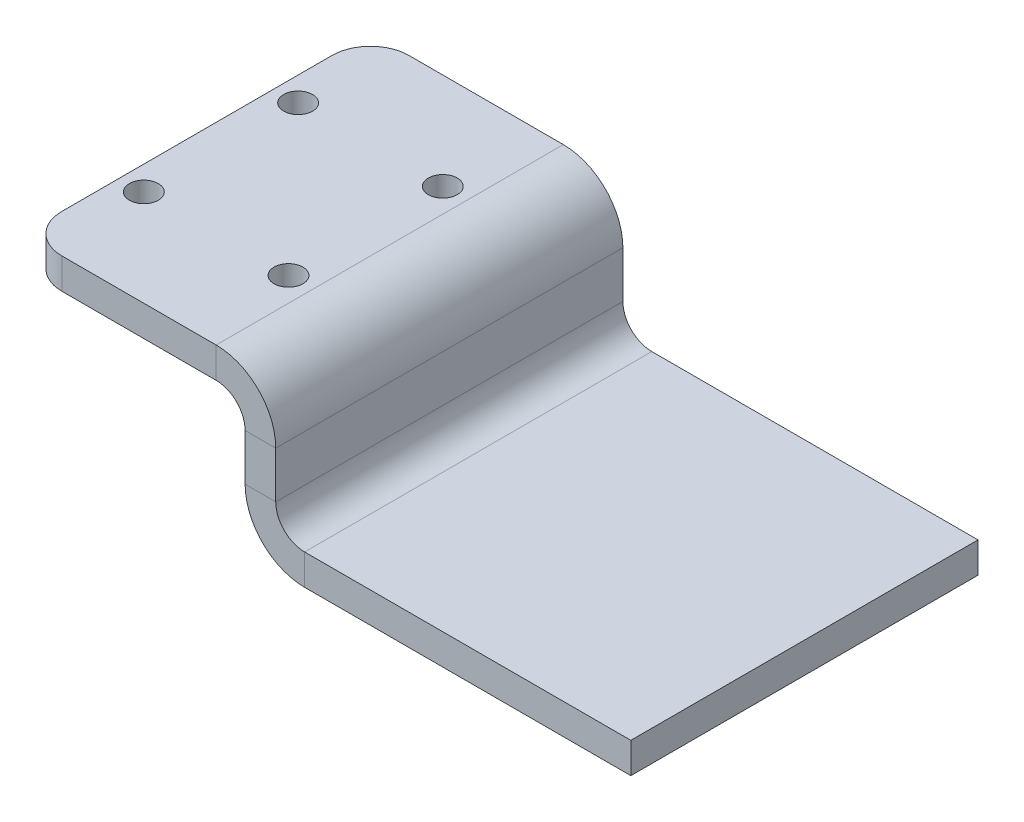
from build123d import *

# Parameters (mm, degrees)
SKETCH2_W                    = 23
SKETCH2_H                    = 36
BASE_FLANGE1_DEPTH           = 3.175
EDGE_FLANGE4_STRIP_W         = 18.7
EDGE_FLANGE4_STRIP_H         = 3.175
EDGE_FLANGE4_STRIP_CUT_DEPTH = 36
EDGE_FLANGE4_DEPTH           = 36
EDGE_FLANGE5_STRIP_W         = 18.7
EDGE_FLANGE5_STRIP_H         = 3.175
EDGE_FLANGE5_STRIP_CUT_DEPTH = 36
EDGE_FLANGE5_DEPTH           = 36
SKETCH20_R                   = 1.5
CUT_EXTRUDE1_DEPTH           = 68.734633866
FILLET1_R                    = 4


# Sheet-metal steps are written as plain solids
with BuildPart() as part:
    # Sketch2 → Base-Flange1 (new body)
    with BuildSketch(Plane(origin=(0, 0, 0), x_dir=(1, 0, 0), z_dir=(0, 1, 0))):
        with Locations((11.5, 0)):
            Rectangle(SKETCH2_W, SKETCH2_H)
    extrude(amount=-BASE_FLANGE1_DEPTH)

    # Edge-Flange4 strip (across the edge) → Edge-Flange4 strip cut (cut)
    with BuildSketch(Plane(origin=(23, -3.175, -18), x_dir=(-1, 0, 0), z_dir=(0, 0, 1))):
        with Locations((-6.35, -1.5875)):
            Rectangle(EDGE_FLANGE4_STRIP_W, EDGE_FLANGE4_STRIP_H)
    extrude(amount=EDGE_FLANGE4_STRIP_CUT_DEPTH, mode=Mode.SUBTRACT)

    # Edge-Flange4 section (across the edge) → Edge-Flange4 (add)
    with BuildSketch(Plane(origin=(23, -3.175, -18), x_dir=(-1, 0, 0), z_dir=(0, 0, 1))):
        with BuildLine():
            Line((-3.175, 3), (-3.175, 10.825))
            Line((-3.175, 10.825), (0, 10.825))
            Line((0, 10.825), (0, 3))
            ThreePointArc((0, 3), (0.878679656, 0.878679656), (3, 0))
            Line((3, 0), (3, -3.175))
            ThreePointArc((3, -3.175), (-1.366384374, -1.366384374), (-3.175, 3))
        make_face()
    extrude(amount=EDGE_FLANGE4_DEPTH)

    # Edge-Flange5 strip (across the edge) → Edge-Flange5 strip cut (cut)
    with BuildSketch(Plane(origin=(26.175, -14, 18), x_dir=(0, 1, 0), z_dir=(0, 0, -1))):
        with Locations((-6.35, -1.5875)):
            Rectangle(EDGE_FLANGE5_STRIP_W, EDGE_FLANGE5_STRIP_H)
    extrude(amount=EDGE_FLANGE5_STRIP_CUT_DEPTH, mode=Mode.SUBTRACT)

    # Edge-Flange5 section (across the edge) → Edge-Flange5 (add)
    with BuildSketch(Plane(origin=(26.175, -14, 18), x_dir=(0, 1, 0), z_dir=(0, 0, -1))):
        with BuildLine():
            Line((-3.175, 3), (-3.175, 36.825))
            Line((-3.175, 36.825), (0, 36.825))
            Line((0, 36.825), (0, 3))
            ThreePointArc((0, 3), (0.878679656, 0.878679656), (3, 0))
            Line((3, 0), (3, -3.175))
            ThreePointArc((3, -3.175), (-1.366384374, -1.366384374), (-3.175, 3))
        make_face()
    extrude(amount=EDGE_FLANGE5_DEPTH)

    # Sketch20 → Cut-Extrude1 (cut, through all)
    with BuildSketch(Plane(origin=(0, 0, 0), x_dir=(1, 0, 0), z_dir=(0, 1, 0))):
        with Locations(Location((17.5, -8, 0), (0, 0, 270))):
            Circle(SKETCH20_R)
        with Locations(Location((17.5, 8, 0), (0, 0, 270))):
            Circle(SKETCH20_R)
        with Locations(Location((2.5, 8, 0), (0, 0, 270))):
            Circle(SKETCH20_R)
        with Locations(Location((2.5, -8, 0), (0, 0, 270))):
            Circle(SKETCH20_R)
    extrude(amount=-CUT_EXTRUDE1_DEPTH, mode=Mode.SUBTRACT)

    # Fillet1
    fillet1_edges = [part.edges().sort_by_distance(p)[0] for p in [
        (0, -1.5875, 18),
        (0, -1.5875, -18),
    ]]
    fillet(fillet1_edges, radius=FILLET1_R)


solid = part.part
